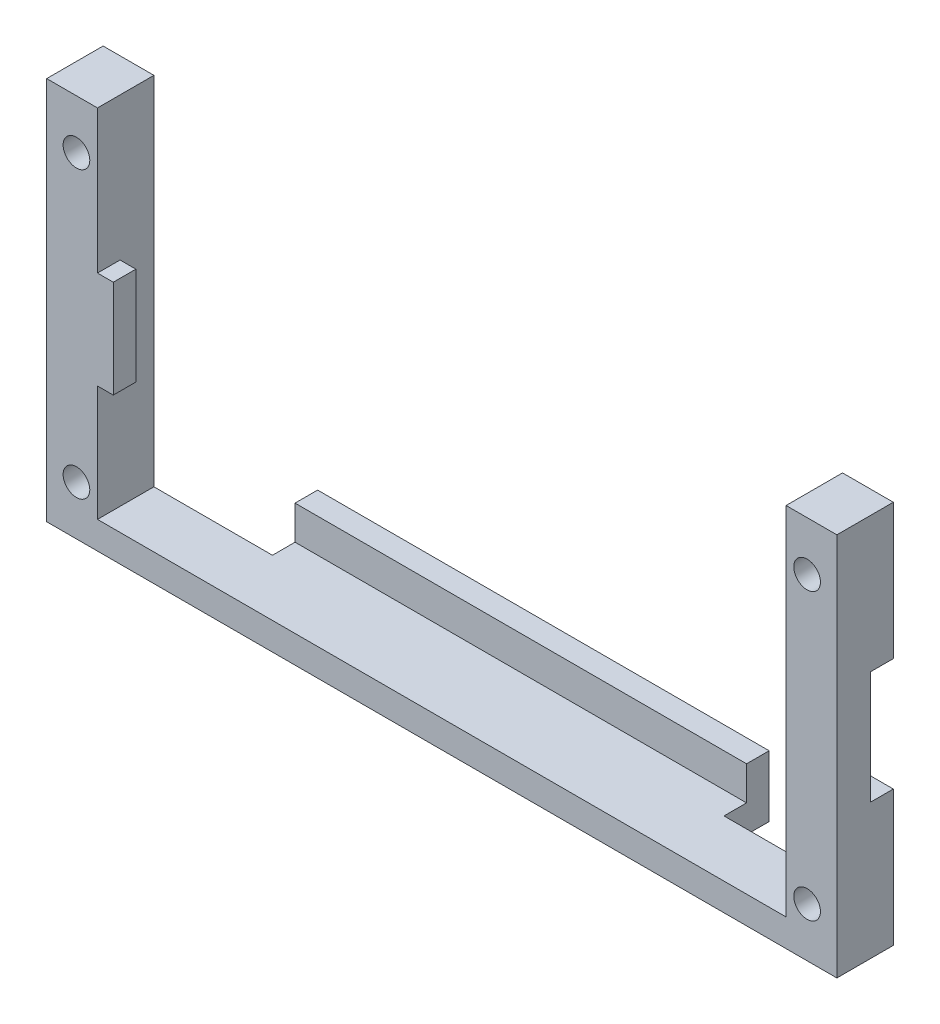
from build123d import *

# Parameters (mm, degrees)
SKETCH1_W           = 88.9
SKETCH1_H           = 43.18
SKETCH1_W_2         = 77.47
SKETCH1_H_2         = 37
BOSS_EXTRUDE1_DEPTH = 6.35
SKETCH2_R           = 1.5
CUT_EXTRUDE1_DEPTH  = 10.16
SKETCH4_W           = 2.54
SKETCH4_H           = 11
BOSS_EXTRUDE3_DEPTH = 1.778
SKETCH5_W           = 77.47
SKETCH5_H           = 3.09
CUT_EXTRUDE2_DEPTH  = 50.822214925
SKETCH6_W           = 50.8
SKETCH6_H           = 3.09
BOSS_EXTRUDE4_DEPTH = 5.08
SKETCH7_W           = 50.8
SKETCH7_H           = 2.54
BOSS_EXTRUDE5_DEPTH = 3.81
SKETCH8_W           = 2.54
SKETCH8_H           = 12.7
CUT_EXTRUDE3_DEPTH  = 87.175372497


with BuildPart() as part:
    # Sketch1 → Boss-Extrude1 (new body)
    with BuildSketch(Plane.XY):
        Rectangle(SKETCH1_W, SKETCH1_H)
        Rectangle(SKETCH1_W_2, SKETCH1_H_2, mode=Mode.SUBTRACT)
    extrude(amount=BOSS_EXTRUDE1_DEPTH)

    # Sketch2 → Cut-Extrude1 (cut)
    with BuildSketch(Plane.XY.offset(6.35)):
        with Locations((41.09999984, 16.049999905)):
            Circle(SKETCH2_R)
        with Locations((-41.09999984, 16.049999905)):
            Circle(SKETCH2_R)
        with Locations((-41.09999984, -16.049999905)):
            Circle(SKETCH2_R)
        with Locations((41.09999984, -16.049999905)):
            Circle(SKETCH2_R)
    extrude(amount=-CUT_EXTRUDE1_DEPTH, mode=Mode.SUBTRACT)

    # Sketch4 → Boss-Extrude3 (add)
    with BuildSketch(Plane(origin=(-38.735, 0, 0), x_dir=(0, 0, -1), z_dir=(1, 0, 0))):
        with Locations((-5.08, 0)):
            Rectangle(SKETCH4_W, SKETCH4_H)
    extrude(amount=BOSS_EXTRUDE3_DEPTH)

    # Sketch5 → Cut-Extrude2 (cut, through all)
    with BuildSketch(Plane(origin=(0, 0, 0), x_dir=(-1, 0, 0), z_dir=(0, 0, -1))):
        with Locations((0, 20.045)):
            Rectangle(SKETCH5_W, SKETCH5_H)
    extrude(amount=-CUT_EXTRUDE2_DEPTH, mode=Mode.SUBTRACT)

    # Sketch6 → Boss-Extrude4 (add)
    with BuildSketch(Plane(origin=(0, 0, 0), x_dir=(-1, 0, 0), z_dir=(0, 0, -1))):
        with Locations((0, -20.045)):
            Rectangle(SKETCH6_W, SKETCH6_H)
    extrude(amount=BOSS_EXTRUDE4_DEPTH)

    # Sketch7 → Boss-Extrude5 (add)
    with BuildSketch(Plane(origin=(0, -18.5, 0), x_dir=(1, 0, 0), z_dir=(0, 1, 0))):
        with Locations((0, 3.81)):
            Rectangle(SKETCH7_W, SKETCH7_H)
    extrude(amount=BOSS_EXTRUDE5_DEPTH)

    # Sketch8 → Cut-Extrude3 (cut, through all)
    with BuildSketch(Plane.ZY.offset(-38.735)):
        with Locations((1.27, 0)):
            Rectangle(SKETCH8_W, SKETCH8_H)
    extrude(amount=-CUT_EXTRUDE3_DEPTH, mode=Mode.SUBTRACT)


solid = part.part
